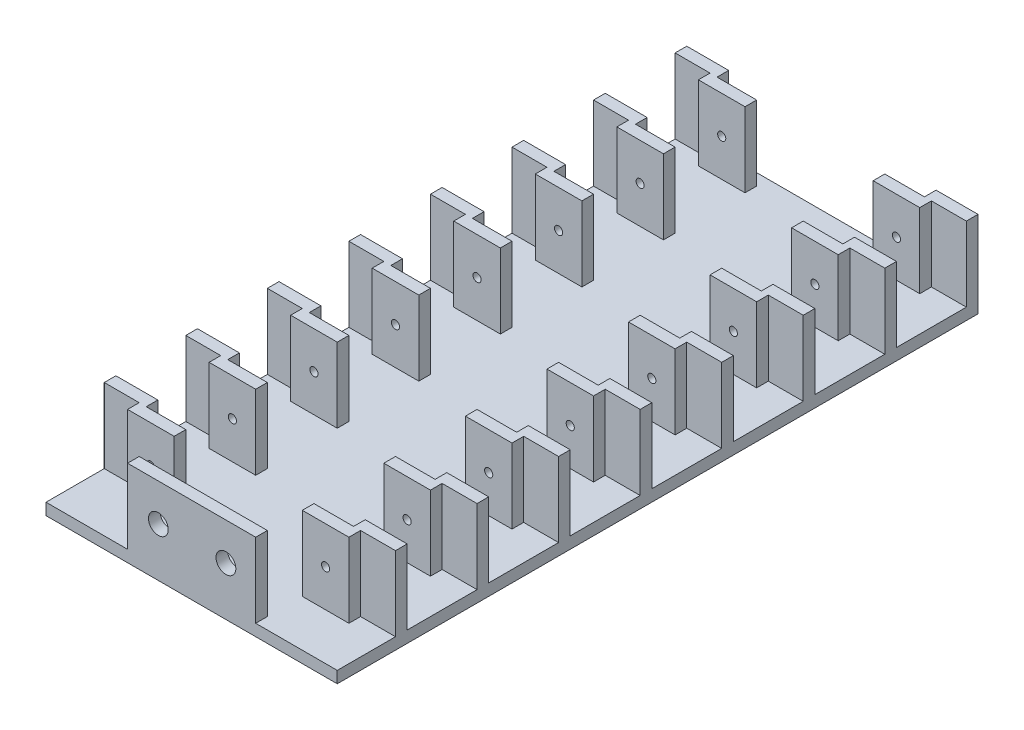
from build123d import *

# Parameters (mm, degrees)
BOSS_EXTRUDE1_DEPTH     = 5
SKETCH2_W               = 125
SKETCH2_H               = 5
BOSS_EXTRUDE2_DEPTH     = 32
SKETCH3_R               = 4.25
CUT_EXTRUDE1_DEPTH      = 286
SKETCH9_W               = 125
SKETCH9_H               = 5
BOSS_EXTRUDE4_DEPTH     = 5
SKETCH10_W              = 18
SKETCH10_H              = 5
BOSS_EXTRUDE8_DEPTH     = 32
BOSS_EXTRUDE9_DEPTH     = 32
CUT_EXTRUDE4_DEPTH      = 250
CUT_EXTRUDE4_DEPTH_BACK = 32
SKETCH8_R               = 1.75
SKETCH13_W              = 35
SKETCH13_H              = 32
CUT_EXTRUDE5_DEPTH      = 11


with BuildPart() as part:
    # Sketch1 → Boss-Extrude1 (new body)
    with BuildSketch(Plane(origin=(0, 0, 0), x_dir=(1, 0, 0), z_dir=(0, 1, 0))):
        Polygon((-14.5, 135), (-37.5, 135), (-62.5, 135), (-62.5, -135), (-37.5, -135), (-14.5, -135), (14.5, -135), (37.5, -135), (62.5, -135), (62.5, 135), (37.5, 135), (14.5, 135), align=None)
    extrude(amount=BOSS_EXTRUDE1_DEPTH)

    # Sketch2 → Boss-Extrude2 (add)
    with BuildSketch(Plane(origin=(0, 5, 0), x_dir=(1, 0, 0), z_dir=(0, 1, 0))):
        with Locations((0, -132.5)):
            Rectangle(SKETCH2_W, SKETCH2_H)
        Polygon((-37.5, 135), (-27.5, 135), (-27.5, 130), (-47.5, 130), (-47.5, 135), align=None)
        Polygon((47.5, 130), (27.5, 130), (27.5, 135), (37.5, 135), (47.5, 135), align=None)
    extrude(amount=BOSS_EXTRUDE2_DEPTH)

    # Sketch3 → Cut-Extrude1 (cut)
    with BuildSketch(Plane.XY.offset(135)):
        with Locations((-14.282856857, 21)):
            Circle(SKETCH3_R)
        with Locations((14.717143143, 21)):
            Circle(SKETCH3_R)
    extrude(amount=-CUT_EXTRUDE1_DEPTH, mode=Mode.SUBTRACT)

    # Sketch9 → Boss-Extrude4 (add)
    with BuildSketch(Plane(origin=(0, 0, -135), x_dir=(-1, 0, 0), z_dir=(0, 0, -1))):
        with Locations((0, 2.5)):
            Rectangle(SKETCH9_W, SKETCH9_H)
    extrude(amount=BOSS_EXTRUDE4_DEPTH)

    # Sketch10 → Boss-Extrude8 (add)
    with BuildSketch(Plane(origin=(0, 5, 0), x_dir=(1, 0, 0), z_dir=(0, 1, 0))):
        with Locations((-53.5, 137.5)):
            Rectangle(SKETCH10_W, SKETCH10_H)
        with Locations((53.5, 137.5)):
            Rectangle(SKETCH10_W, SKETCH10_H)
    extrude(amount=BOSS_EXTRUDE8_DEPTH)

    # Sketch11 → Boss-Extrude9 (add)
    with BuildSketch(Plane(origin=(0, 5, 0), x_dir=(1, 0, 0), z_dir=(0, 1, 0))):
        Polygon((-47.5, -115), (-27.5, -115), (-27.5, -110), (-44.5, -110), (-44.5, -105), (-62.5, -105), (-62.5, -110), (-47.5, -110), align=None)
        Polygon((-62.5, 105), (-62.5, 100), (-47.5, 100), (-47.5, 95), (-27.5, 95), (-27.5, 100), (-44.5, 100), (-44.5, 105), align=None)
        Polygon((-62.5, 70), (-62.5, 65), (-47.5, 65), (-47.5, 60), (-27.5, 60), (-27.5, 65), (-44.5, 65), (-44.5, 70), align=None)
        Polygon((-62.5, 35), (-62.5, 30), (-47.5, 30), (-47.5, 25), (-27.5, 25), (-27.5, 30), (-44.5, 30), (-44.5, 35), align=None)
        Polygon((-62.5, 0), (-62.5, -5), (-47.5, -5), (-47.5, -10), (-27.5, -10), (-27.5, -5), (-44.5, -5), (-44.5, 0), align=None)
        Polygon((-62.5, -35), (-62.5, -40), (-47.5, -40), (-47.5, -45), (-27.5, -45), (-27.5, -40), (-44.5, -40), (-44.5, -35), align=None)
        Polygon((-62.5, -70), (-62.5, -75), (-47.5, -75), (-47.5, -80), (-27.5, -80), (-27.5, -75), (-44.5, -75), (-44.5, -70), align=None)
        Polygon((47.5, 100), (62.5, 100), (62.5, 105), (44.5, 105), (44.5, 100), (27.5, 100), (27.5, 95), (47.5, 95), align=None)
        Polygon((47.5, 65), (62.5, 65), (62.5, 70), (44.5, 70), (44.5, 65), (27.5, 65), (27.5, 60), (47.5, 60), align=None)
        Polygon((47.5, 30), (62.5, 30), (62.5, 35), (44.5, 35), (44.5, 30), (27.5, 30), (27.5, 25), (47.5, 25), align=None)
        Polygon((47.5, -5), (62.5, -5), (62.5, 0), (44.5, 0), (44.5, -5), (27.5, -5), (27.5, -10), (47.5, -10), align=None)
        Polygon((47.5, -40), (62.5, -40), (62.5, -35), (44.5, -35), (44.5, -40), (27.5, -40), (27.5, -45), (47.5, -45), align=None)
        Polygon((47.5, -75), (62.5, -75), (62.5, -70), (44.5, -70), (44.5, -75), (27.5, -75), (27.5, -80), (47.5, -80), align=None)
        Polygon((44.5, -105), (44.5, -110), (27.5, -110), (27.5, -115), (47.5, -115), (47.5, -110), (62.5, -110), (62.5, -105), align=None)
    extrude(amount=BOSS_EXTRUDE9_DEPTH)

    # Sketch8 → Cut-Extrude4 (cut, two sides: drawn at the far end of the back side and taken through both)
    with BuildSketch(Plane.XY.offset(-130).offset(-CUT_EXTRUDE4_DEPTH_BACK)):
        with Locations((-37.5, 21)):
            Circle(SKETCH8_R)
        with Locations((37.5, 21)):
            Circle(SKETCH8_R)
    extrude(amount=CUT_EXTRUDE4_DEPTH + CUT_EXTRUDE4_DEPTH_BACK, mode=Mode.SUBTRACT)

    # Sketch13 → Cut-Extrude5 (cut)
    with BuildSketch(Plane.XY.offset(135)):
        with Locations((-45, 21)):
            Rectangle(SKETCH13_W, SKETCH13_H)
        with Locations((45, 21)):
            Rectangle(SKETCH13_W, SKETCH13_H)
    extrude(amount=-CUT_EXTRUDE5_DEPTH, mode=Mode.SUBTRACT)


solid = part.part
